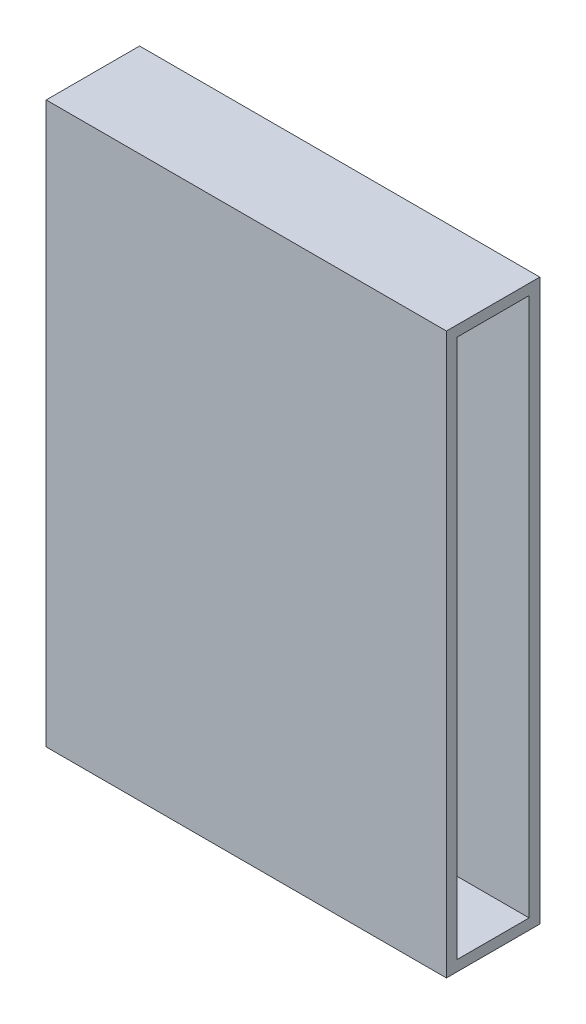
from build123d import *

# Parameters (mm, degrees)
SKETCH1_W           = 30
SKETCH1_H           = 42
BOSS_EXTRUDE1_DEPTH = 7
SKETCH2_W           = 5.4
SKETCH2_H           = 40.4
CUT_EXTRUDE1_DEPTH  = 53.086466572


with BuildPart() as part:
    # Sketch1 → Boss-Extrude1 (new body)
    with BuildSketch(Plane.XY):
        with Locations((15, 21)):
            Rectangle(SKETCH1_W, SKETCH1_H)
    extrude(amount=BOSS_EXTRUDE1_DEPTH)

    # Sketch2 → Cut-Extrude1 (cut, through all)
    with BuildSketch(Plane.ZY):
        with Locations((3.5, 21)):
            Rectangle(SKETCH2_W, SKETCH2_H)
    extrude(amount=-CUT_EXTRUDE1_DEPTH, mode=Mode.SUBTRACT)


solid = part.part
